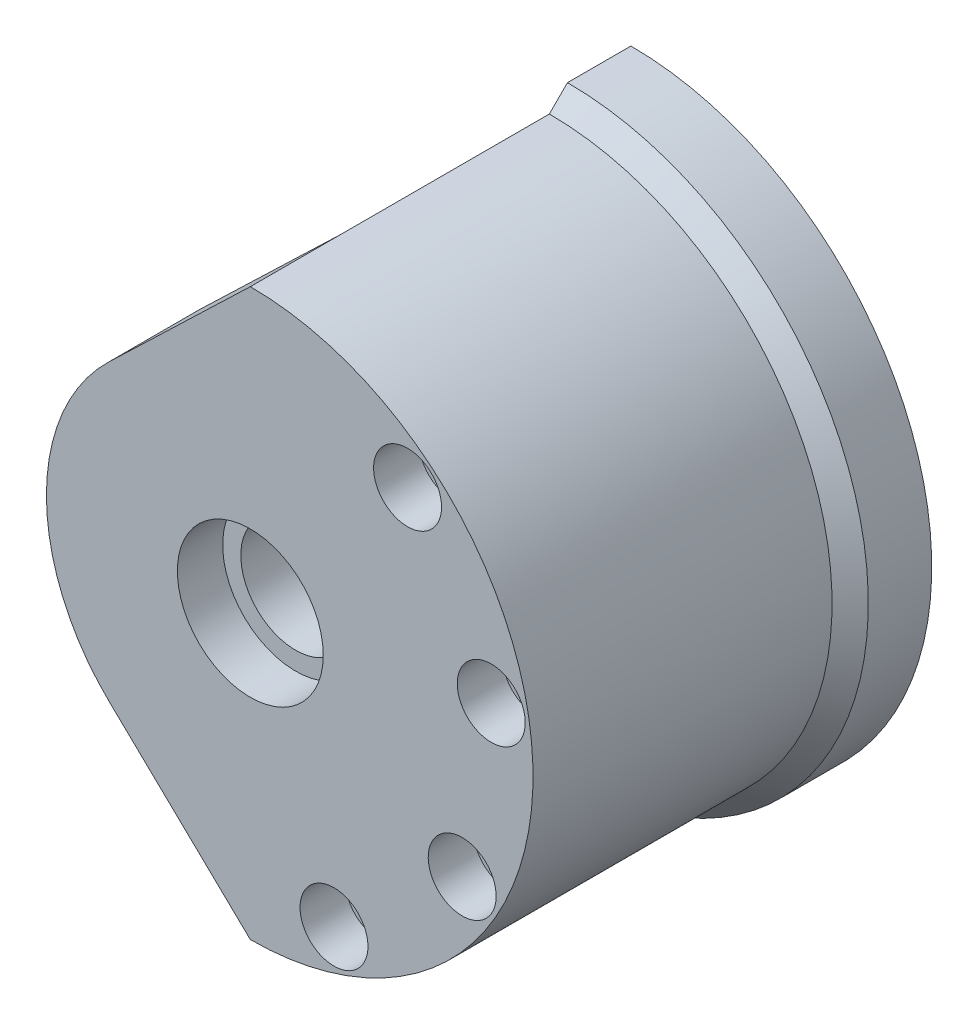
from build123d import *

# Parameters (mm, degrees)
SCHIZZO1_R                        = 31.2
SCHIZZO1_R_2                      = 22.5
ESTRUSIONE_ESTRUSIONE1_DEPTH      = 40
SCHIZZO2_R                        = 2.25
TAGLIO_ESTRUSIONE1_DEPTH          = 60.555688225
RIPETIZIONECIRCOLARE1_COUNT       = 9
SCHIZZO3_W                        = 40
SCHIZZO3_H                        = 62.4
TAGLIO_ESTRUSIONE2_DEPTH          = 39
ESTRUSIONE_ESTRUSIONE2_START      = -10
ESTRUSIONE_ESTRUSIONE2_DEPTH      = 10
SCHIZZO5_R                        = 8.05
TAGLIO_ESTRUSIONE3_DEPTH          = 5
SCHIZZO6_R                        = 6.05
TAGLIO_ESTRUSIONE6_DEPTH          = 57.31944602
SCHIZZO7_R                        = 3.75
TAGLIO_ESTRUSIONE7_DEPTH          = 5
RIPETIZIONECIRCOLARE2_COUNT       = 9
ESTRUSIONE_ESTRUSIONE3_DEPTH      = 2
ESTRUSIONE_ESTRUSIONE3_DEPTH_BACK = 5
SMUSSO1_SIZE                      = 2
RACCORDO2_R                       = 4
ESTRUSIONE_ESTRUSIONE4_DEPTH      = 40
ESTRUSIONE_ESTRUSIONE5_START      = -10
ESTRUSIONE_ESTRUSIONE5_DEPTH      = 10


# Some blends are built 0.0001 mm under size
with BuildPart() as part:
    # Schizzo1 → Estrusione-Estrusione1 (new body)
    with BuildSketch(Plane.XY):
        Circle(SCHIZZO1_R)
        Circle(SCHIZZO1_R_2, mode=Mode.SUBTRACT)
    extrude(amount=ESTRUSIONE_ESTRUSIONE1_DEPTH)

    # Schizzo2 → Taglio-Estrusione1 (cut, through all)
    with BuildSketch(Plane.XY.offset(40)):
        with Locations((0, 27)):
            Circle(SCHIZZO2_R)
    taglio_estrusione1 = extrude(amount=-TAGLIO_ESTRUSIONE1_DEPTH, mode=Mode.SUBTRACT)

    # RipetizioneCircolare1: Taglio-Estrusione1 ×9 about axis
    ripetizionecircolare1_axis = Axis((0, 0, 0), (0, 0, 1))
    for i in range(1, RIPETIZIONECIRCOLARE1_COUNT):
        add(taglio_estrusione1.rotate(ripetizionecircolare1_axis, i * 360 / RIPETIZIONECIRCOLARE1_COUNT), mode=Mode.SUBTRACT)

    # Schizzo3 → Taglio-Estrusione2 (cut)
    with BuildSketch(Plane(origin=(0, 0, 0), x_dir=(0, 0, -1), z_dir=(1, 0, 0))):
        with Locations((-20, 0)):
            Rectangle(SCHIZZO3_W, SCHIZZO3_H)
    extrude(amount=-TAGLIO_ESTRUSIONE2_DEPTH, mode=Mode.SUBTRACT)

    # Schizzo4 → Estrusione-Estrusione2 (add)
    with BuildSketch(Plane.XY.offset(40).offset(ESTRUSIONE_ESTRUSIONE2_START)):
        with BuildLine():
            Line((0, 22.5), (0, -22.5))
            ThreePointArc((0, -22.5), (22.5, 0), (0, 22.5))
        make_face()
        with BuildLine():
            ThreePointArc((22.5, 0), (15.909902577, 15.909902577), (0, 22.5))
            Line((0, 22.5), (0, -22.5))
            ThreePointArc((0, -22.5), (15.909902577, -15.909902577), (22.5, 0))
        make_face()
        with BuildLine():
            Line((0, -22.5), (0, 22.5))
            ThreePointArc((0, 22.5), (-22.5, 0), (0, -22.5))
        make_face()
    extrude(amount=ESTRUSIONE_ESTRUSIONE2_DEPTH)

    # Schizzo5 → Taglio-Estrusione3 (cut)
    with BuildSketch(Plane.XY.offset(40)):
        Circle(SCHIZZO5_R)
    extrude(amount=-TAGLIO_ESTRUSIONE3_DEPTH, mode=Mode.SUBTRACT)

    # Schizzo6 → Taglio-Estrusione6 (cut, through all)
    with BuildSketch(Plane.XY.offset(35)):
        Circle(SCHIZZO6_R)
    extrude(amount=-TAGLIO_ESTRUSIONE6_DEPTH, mode=Mode.SUBTRACT)

    # Schizzo7 → Taglio-Estrusione7 (cut)
    with BuildSketch(Plane.XY.offset(40)):
        with Locations((17.355265462, 20.683199964)):
            Circle(SCHIZZO7_R)
    taglio_estrusione7 = extrude(amount=-TAGLIO_ESTRUSIONE7_DEPTH, mode=Mode.SUBTRACT)

    # RipetizioneCircolare2: Taglio-Estrusione7 ×9 about axis
    ripetizionecircolare2_axis = Axis((0, 0, 0), (0, 0, 1))
    for i in range(1, RIPETIZIONECIRCOLARE2_COUNT):
        add(taglio_estrusione7.rotate(ripetizionecircolare2_axis, i * 360 / RIPETIZIONECIRCOLARE2_COUNT), mode=Mode.SUBTRACT)

    # Schizzo8 → Estrusione-Estrusione3 (add, two sides: drawn at the far end of the back side and taken through both)
    with BuildSketch(Plane(origin=(0, 0, 0), x_dir=(-1, 0, 0), z_dir=(0, 0, -1)).offset(-ESTRUSIONE_ESTRUSIONE3_DEPTH_BACK)):
        with BuildLine():
            Line((0, 31.2), (0, 33.2))
            ThreePointArc((0, 33.2), (-33.2, 0), (0, -33.2))
            Line((0, -33.2), (0, -31.2))
            ThreePointArc((0, -31.2), (-31.2, 0), (0, 31.2))
        make_face()
    extrude(amount=ESTRUSIONE_ESTRUSIONE3_DEPTH + ESTRUSIONE_ESTRUSIONE3_DEPTH_BACK)

    # Smusso1
    smusso1_edges = [part.edges().sort_by_distance(p)[0] for p in [
        (31.2, 0, 5),
    ]]
    chamfer(smusso1_edges, length=SMUSSO1_SIZE - 0.0001)  # a hair under: the kernel refuses the full size

    # Raccordo2
    # the kernel refuses this fillet: 4 mm, written as the material it adds along each edge
    with BuildSketch(Plane(origin=(0, 0, 30), x_dir=(0, -1, 0), z_dir=(-1, 0, 0))) as raccordo2_piece_1:
        with BuildLine():
            CenterArc((22.5 - RACCORDO2_R, -RACCORDO2_R), RACCORDO2_R, 0, 90)
            Line((22.5 - RACCORDO2_R, 0), (22.5, 0))
            Line((22.5, 0), (22.5, -RACCORDO2_R))
        make_face()
    revolve(axis=Axis((0, 0, 30), (0, 0, 1)), revolution_arc=180)

    # Schizzo9 → Estrusione-Estrusione4 (add)
    with BuildSketch(Plane.XY.offset(40)):
        with BuildLine():
            Line((0, 30.75), (0, 23.25))
            ThreePointArc((0, 23.25), (3.75, 27), (0, 30.75))
        make_face()
    extrude(amount=-ESTRUSIONE_ESTRUSIONE4_DEPTH)

    # Schizzo10 → Estrusione-Estrusione5 (add)
    with BuildSketch(Plane.XY.offset(40).offset(ESTRUSIONE_ESTRUSIONE5_START)):
        with BuildLine():
            Line((0, 22.5), (0, 31.2))
            Line((0, 31.2), (-15.587436356, 16.225961538))
            ThreePointArc((-15.587436356, 16.225961538), (-8.40136493, 20.872639203), (0, 22.5))
        make_face()
        with BuildLine():
            ThreePointArc((0, -22.5), (-8.40136493, -20.872639203), (-15.587436356, -16.225961538))
            Line((-15.587436356, -16.225961538), (0, -31.2))
            Line((0, -31.2), (0, -22.5))
        make_face()
    extrude(amount=ESTRUSIONE_ESTRUSIONE5_DEPTH)


solid = part.part
